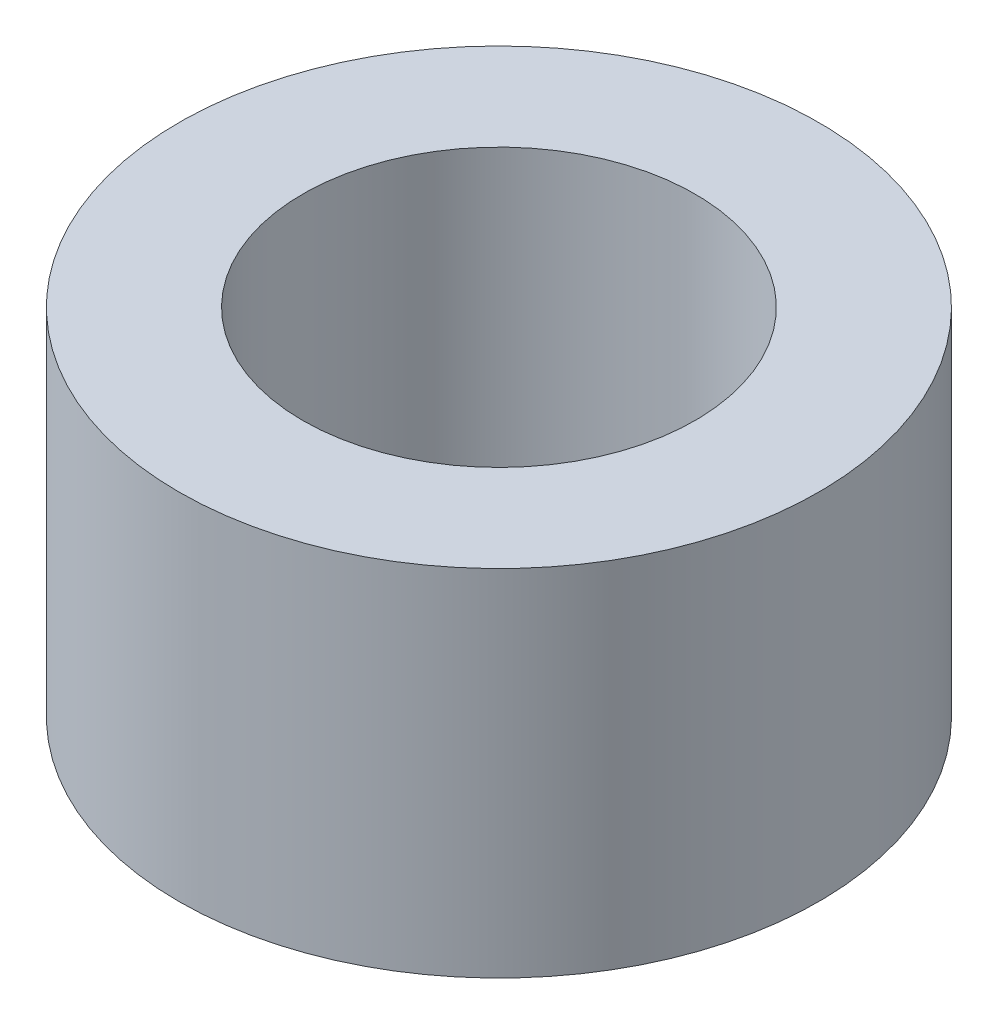
from build123d import *

# Parameters (mm, degrees)
SKETCH1_R           = 64.964891119
BOSS_EXTRUDE1_DEPTH = 72
SKETCH2_R           = 39.826869817
CUT_EXTRUDE1_DEPTH  = 72


with BuildPart() as part:
    # Sketch1 → Boss-Extrude1 (new body)
    with BuildSketch(Plane(origin=(0, 0, 0), x_dir=(1, 0, 0), z_dir=(0, 1, 0))):
        Circle(SKETCH1_R)
    extrude(amount=BOSS_EXTRUDE1_DEPTH)

    # Sketch2 → Cut-Extrude1 (cut)
    with BuildSketch(Plane(origin=(0, 72, 0), x_dir=(1, 0, 0), z_dir=(0, 1, 0))):
        Circle(SKETCH2_R)
    extrude(amount=-CUT_EXTRUDE1_DEPTH, mode=Mode.SUBTRACT)


solid = part.part
